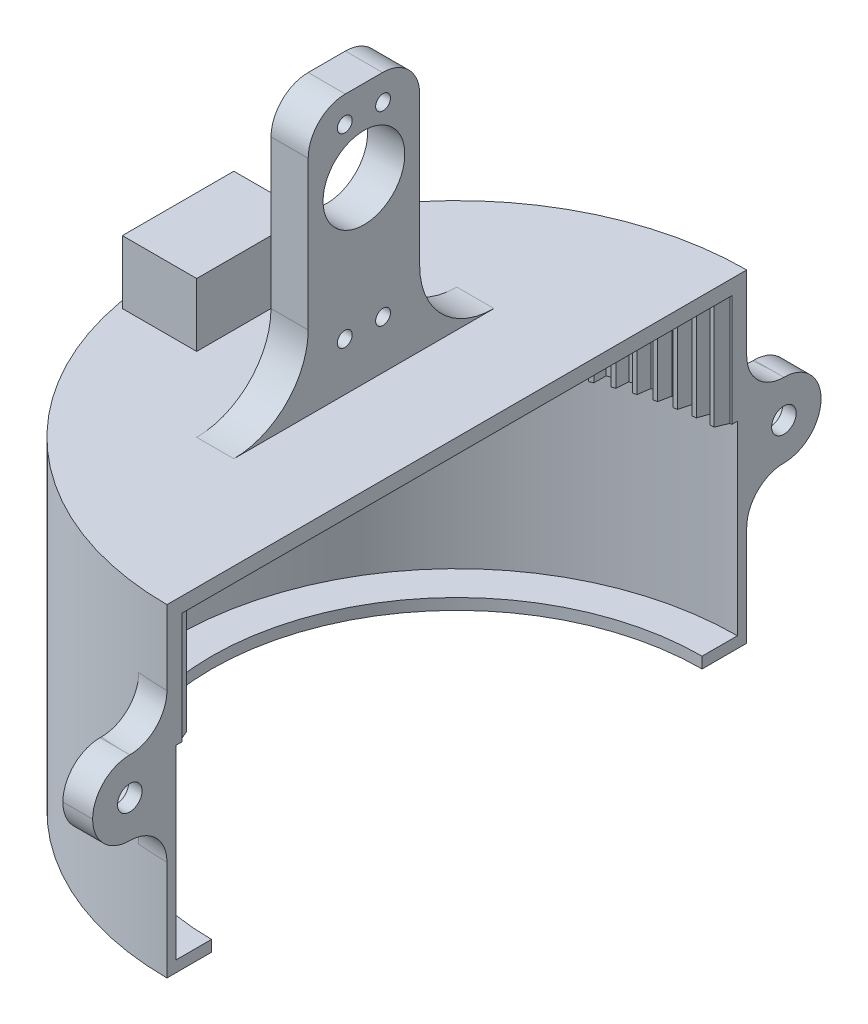
from build123d import *
from OCP.BRepFilletAPI import BRepFilletAPI_MakeFillet

# Parameters (mm, degrees)
SKETCH1_R                       = 78
SKETCH1_R_2                     = 66
BOSS_EXTRUDE1_DEPTH             = 3
SKETCH2_R                       = 78
SKETCH2_R_2                     = 71
BOSS_EXTRUDE2_DEPTH             = 80
CUT_EXTRUDE1_START              = -78
CUT_EXTRUDE1_DEPTH              = 217.047093414
CIRPATTERN4_COUNT               = 98
SKETCH9_R                       = 75.5
SKETCH9_R_2                     = 67.5
CUT_EXTRUDE3_DEPTH              = 50
SKETCH10_R                      = 78
BOSS_EXTRUDE6_DEPTH             = 4
SKETCH11_W                      = 10
SKETCH11_H                      = 30
BOSS_EXTRUDE7_DEPTH             = 70
CIRPATTERN5_COUNT               = 2
SPLIT1_START                    = 0.5
SPLIT1_OUTLINE_W                = 70
SPLIT1_OUTLINE_H                = 30
SPLIT1_OUTLINE_W_2              = 30
SPLIT1_OUTLINE_H_2              = 147.956859644
SPLIT1_DEPTH                    = 77.5
SPLIT1_2_DEPTH                  = 87
BOSS_EXTRUDE8_REACH             = 236.668
BOSS_EXTRUDE8_END_RADIUS        = 78
SKETCH14_W                      = 8
SKETCH14_H                      = 20
BOSS_EXTRUDE8_DIRECTION_2_DEPTH = 20
FILLET2_R                       = 10
BOSS_EXTRUDE9_REACH             = 250.413
BOSS_EXTRUDE9_END_RADIUS        = 78
SKETCH18_W                      = 8
SKETCH18_H                      = 20
BOSS_EXTRUDE9_DIRECTION_2_DEPTH = 20
FILLET3_R                       = 10
SKETCH27_R                      = 11
CUT_EXTRUDE6_DEPTH              = 191.005263137
SKETCH29_R                      = 2
CUT_EXTRUDE7_DEPTH              = 191.005263137
LPATTERN1_COUNT                 = 2
LPATTERN1_PITCH                 = 10.3
LPATTERN1_COUNT_DIR2            = 2
LPATTERN1_PITCH_DIR2            = 50
FILLET4_R1                      = 20
FILLET4_R2                      = 10
SKETCH30_W                      = 20
SKETCH30_H                      = 30
BOSS_EXTRUDE10_DEPTH            = 17


# Read off the part's stored shape, not the designer's step: Split1
with BuildPart() as part:
    # Sketch1 → Boss-Extrude1 (new body)
    with BuildSketch(Plane(origin=(0, 0, 0), x_dir=(1, 0, 0), z_dir=(0, 1, 0))):
        with Locations(Location((0, 0, 0), (0, 0, 270))):
            Circle(SKETCH1_R)
        with Locations(Location((0, 0, 0), (0, 0, 270))):
            Circle(SKETCH1_R_2, mode=Mode.SUBTRACT)
    extrude(amount=BOSS_EXTRUDE1_DEPTH)

    # Sketch2 → Boss-Extrude2 (add)
    with BuildSketch(Plane(origin=(0, 3, 0), x_dir=(1, 0, 0), z_dir=(0, 1, 0))):
        with Locations(Location((0, 0, 0), (0, 0, 270))):
            Circle(SKETCH2_R)
        with Locations(Location((0, 0, 0), (0, 0, 270))):
            Circle(SKETCH2_R_2, mode=Mode.SUBTRACT)
    extrude(amount=BOSS_EXTRUDE2_DEPTH)

    # Sketch7 → Cut-Extrude1 (cut)
    with BuildSketch(Plane(origin=(0, 83, 0), x_dir=(1, 0, 0), z_dir=(0, 1, 0)).offset(CUT_EXTRUDE1_START)):
        with BuildLine():
            Line((-0.5, 73.978429822), (-1.75, 70.978429822))
            ThreePointArc((-1.75, 70.978429822), (0, 71), (1.75, 70.978429822))
            Line((1.75, 70.978429822), (0.5, 73.978429822))
            Line((0.5, 73.978429822), (-0.5, 73.978429822))
        make_face()
    cut_extrude1 = extrude(amount=CUT_EXTRUDE1_DEPTH, mode=Mode.SUBTRACT)

    # CirPattern4: Cut-Extrude1 ×98 about axis
    cirpattern4_axis = Axis((0, 0, 0), (0, 1, 0))
    for i in range(1, CIRPATTERN4_COUNT):
        add(cut_extrude1.rotate(cirpattern4_axis, i * 360 / CIRPATTERN4_COUNT), mode=Mode.SUBTRACT)

    # Sketch9 → Cut-Extrude3 (cut)
    with BuildSketch(Plane(origin=(0, 3, 0), x_dir=(1, 0, 0), z_dir=(0, 1, 0))):
        with Locations(Location((0, 0, 0), (0, 0, 270))):
            Circle(SKETCH9_R)
        Circle(SKETCH9_R_2, mode=Mode.SUBTRACT)
    extrude(amount=CUT_EXTRUDE3_DEPTH, mode=Mode.SUBTRACT)

    # Sketch10 → Boss-Extrude6 (add)
    with BuildSketch(Plane(origin=(0, 83, 0), x_dir=(1, 0, 0), z_dir=(0, 1, 0))):
        with Locations(Location((0, 0, 0), (0, 0, 270))):
            Circle(SKETCH10_R)
    extrude(amount=BOSS_EXTRUDE6_DEPTH)

    # Sketch11 → Boss-Extrude7 (add)
    with BuildSketch(Plane(origin=(0, 87, 0), x_dir=(1, 0, 0), z_dir=(0, 1, 0))):
        with Locations((-30, 0)):
            Rectangle(SKETCH11_W, SKETCH11_H)
    boss_extrude7 = extrude(amount=BOSS_EXTRUDE7_DEPTH)

    # CirPattern5: Boss-Extrude7 ×2 about axis
    cirpattern5_axis = Axis((0, 0, 0), (0, 1, 0))
    for i in range(1, CIRPATTERN5_COUNT):
        add(boss_extrude7.rotate(cirpattern5_axis, i * 360 / CIRPATTERN5_COUNT))

    # Split1 outline → Split1 (cut)
    with BuildSketch(Plane.YZ.offset(SPLIT1_START)):
        with Locations((122, 0)):
            Rectangle(SPLIT1_OUTLINE_W, SPLIT1_OUTLINE_H)
        with Locations((68, 0)):
            Rectangle(SPLIT1_OUTLINE_W_2, SPLIT1_OUTLINE_H_2)
    extrude(amount=SPLIT1_DEPTH, mode=Mode.SUBTRACT)

    # Split1 2 outline → Split1 2 (cut)
    with BuildSketch(Plane(origin=(0, 0, 0), x_dir=(1, 0, 0), z_dir=(0, 1, 0))):
        with BuildLine():
            ThreePointArc((0, -78), (78, 0), (0, 78))
            Line((0, 78), (0, -78))
        make_face()
    extrude(amount=SPLIT1_2_DEPTH, mode=Mode.SUBTRACT)

    # Boss-Extrude8: up to this cylinder (the profile starts outside it)
    boss_extrude8_end = Plane(origin=(0, 47, 0), z_dir=(0, -1, 0)) * Cylinder(BOSS_EXTRUDE8_END_RADIUS, 630.336, mode=Mode.PRIVATE)
    # Sketch14 → Boss-Extrude8 (add, up to the surface)
    with BuildSketch(Plane.XY.offset(-78), mode=Mode.PRIVATE) as boss_extrude8_sk1:
        with Locations((-4, 47)):
            Rectangle(SKETCH14_W, SKETCH14_H)
    boss_extrude8_tool1 = extrude(boss_extrude8_sk1.sketch, amount=BOSS_EXTRUDE8_REACH, mode=Mode.PRIVATE) - boss_extrude8_end
    add(boss_extrude8_tool1.solids().sort_by_distance((-4, 47, -78))[0])

    # Sketch14 → Boss-Extrude8 direction 2 (add)
    with BuildSketch(Plane.XY.offset(-78)):
        with Locations((-4, 47)):
            Rectangle(SKETCH14_W, SKETCH14_H)
    extrude(amount=-BOSS_EXTRUDE8_DIRECTION_2_DEPTH)

    # Fillet2
    fillet2_edges = [part.edges().sort_by_distance(p)[0] for p in [
        (-4, 37, -98),
        (-4.005284055, 37, -77.897096863),
        (-4.005284055, 57, -77.897096863),
        (-4, 57, -98),
    ]]
    fillet(fillet2_edges, radius=FILLET2_R - 0.0001)  # a hair under: the kernel refuses the full size

    # Sketch22 → CBORE for M6 Hex Head Bolt1 (revolve, cut)
    with BuildSketch(Plane(origin=(-8, 47, -88), x_dir=(0, 0, 1), z_dir=(0, 1, 0))):
        Polygon((0, 0), (0, 8), (3.3, 8), (3.3, 4.38), (7.275, 4.38), (7.275, 0.025), (7.3, 0), align=None)
    revolve(axis=Axis((-14.35, 47, -88), (1, 0, 0)), mode=Mode.SUBTRACT)

    # Boss-Extrude9: up to this cylinder (the profile starts outside it)
    boss_extrude9_end = Plane(origin=(0, 47, 0), z_dir=(0, -1, 0)) * Cylinder(BOSS_EXTRUDE9_END_RADIUS, 657.826, mode=Mode.PRIVATE)
    # Sketch18 → Boss-Extrude9 (add, up to the surface)
    with BuildSketch(Plane.XY.offset(78), mode=Mode.PRIVATE) as boss_extrude9_sk1:
        with Locations((-4, 47)):
            Rectangle(SKETCH18_W, SKETCH18_H)
    boss_extrude9_tool1 = extrude(boss_extrude9_sk1.sketch, amount=-BOSS_EXTRUDE9_REACH, mode=Mode.PRIVATE) - boss_extrude9_end
    add(boss_extrude9_tool1.solids().sort_by_distance((-4, 47, 78))[0])

    # Sketch18 → Boss-Extrude9 direction 2 (add)
    with BuildSketch(Plane.XY.offset(78)):
        with Locations((-4, 47)):
            Rectangle(SKETCH18_W, SKETCH18_H)
    extrude(amount=BOSS_EXTRUDE9_DIRECTION_2_DEPTH)

    # Fillet3
    fillet3_edges = [part.edges().sort_by_distance(p)[0] for p in [
        (-4.005284055, 37, 77.897096863),
        (-4, 37, 98),
        (-4, 57, 98),
        (-4.005284055, 57, 77.897096863),
    ]]
    fillet(fillet3_edges, radius=FILLET3_R - 0.0001)  # a hair under: the kernel refuses the full size

    # Sketch24 → CBORE for M6 Hex Head Bolt2 (revolve, cut)
    with BuildSketch(Plane(origin=(-8, 47, 88), x_dir=(0, 0, 1), z_dir=(0, 1, 0))):
        Polygon((0, 0), (0, 8), (3.3, 8), (3.3, 4.38), (7.275, 4.38), (7.275, 0.025), (7.3, 0), align=None)
    revolve(axis=Axis((-14.35, 47, 88), (1, 0, 0)), mode=Mode.SUBTRACT)

    # Sketch27 → Cut-Extrude6 (cut, through all)
    with BuildSketch(Plane.ZY.offset(35)):
        with Locations((0, 135)):
            Circle(SKETCH27_R)
    extrude(amount=-CUT_EXTRUDE6_DEPTH, mode=Mode.SUBTRACT)

    # Sketch29 → Cut-Extrude7 (cut, through all)
    with BuildSketch(Plane.ZY.offset(35)):
        with Locations((5.15, 100)):
            Circle(SKETCH29_R)
    cut_extrude7 = extrude(amount=-CUT_EXTRUDE7_DEPTH, mode=Mode.SUBTRACT)

    # LPattern1: Cut-Extrude7 2 × 2
    with Locations(*[(0, j * LPATTERN1_PITCH_DIR2, -i * LPATTERN1_PITCH) for i in range(LPATTERN1_COUNT) for j in range(LPATTERN1_COUNT_DIR2) if (i, j) != (0, 0)]):
        add(cut_extrude7, mode=Mode.SUBTRACT)

    # Fillet4: one fillet with a radius per group of edges: ONE call of the kernel's fillet builder (fillet() takes one radius for all edges)
    fillet4_edges_1 = [part.edges().sort_by_distance(p)[0] for p in [
        (-30, 87, -15),
        (-30, 87, 15),
    ]]
    fillet4_edges_2 = [part.edges().sort_by_distance(p)[0] for p in [
        (-30, 157, 15),
        (-30, 157, -15),
    ]]
    fillet4 = BRepFilletAPI_MakeFillet(part.part.solid().wrapped)
    for e in fillet4_edges_1:
        fillet4.Add(FILLET4_R1, e.wrapped)
    for e in fillet4_edges_2:
        fillet4.Add(FILLET4_R2, e.wrapped)
    add(Compound.cast(fillet4.Shape()), mode=Mode.REPLACE)

    # Sketch30 → Boss-Extrude10 (add)
    with BuildSketch(Plane(origin=(0, 87, 0), x_dir=(1, 0, 0), z_dir=(0, 1, 0))):
        with Locations((-65, 0)):
            Rectangle(SKETCH30_W, SKETCH30_H)
    extrude(amount=BOSS_EXTRUDE10_DEPTH)


solid = part.part
